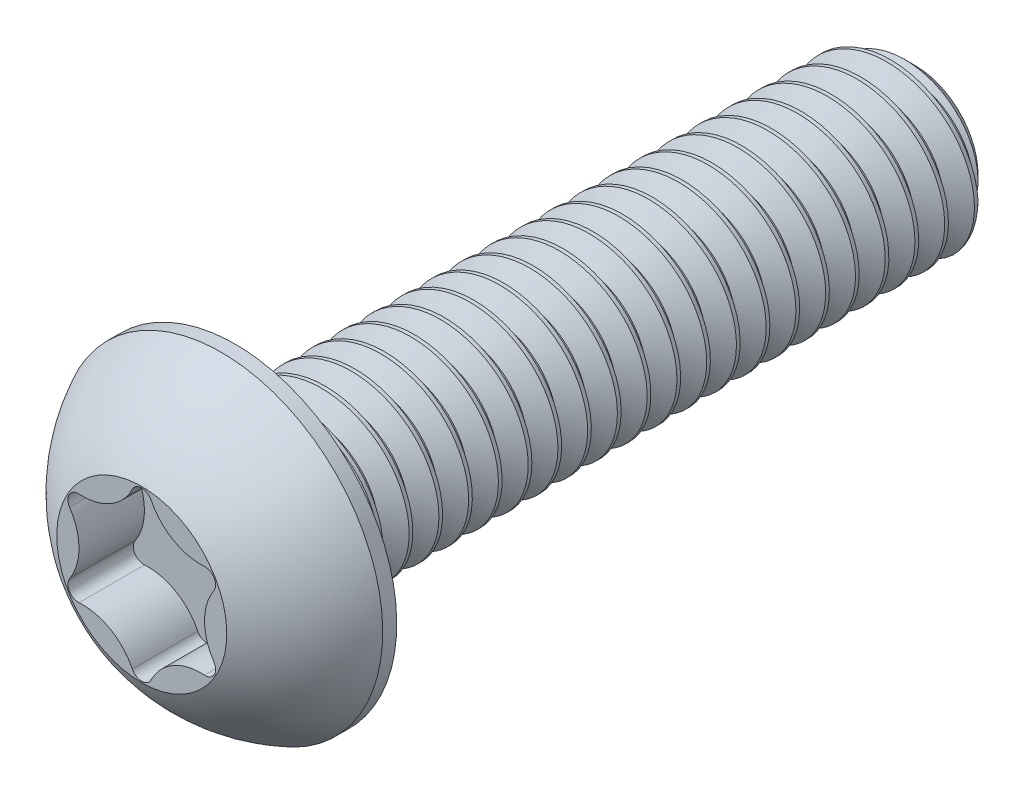
from build123d import *

# Parameters (mm, degrees)
SKETCH12_W         = 16
SKETCH12_H         = 2
CUT_EXTRUDE4_DEPTH = 1.54
CIRPATTERN1_COUNT  = 6
CHAMFER1_SIZE      = 0.525
CUT_SWEEP1_PITCH   = 0.7
CUT_SWEEP1_TO      = 16


with BuildPart() as part:
    # Sketch12 → Revolve1 (revolve)
    with BuildSketch(Plane(origin=(0, 0, 0), x_dir=(0, 0, -1), z_dir=(1, 0, 0))):
        with Locations((0, 1)):
            Rectangle(SKETCH12_W, SKETCH12_H)
    revolve(axis=Axis((0, 0, -8), (0, 0, 1)))

    # Sketch7 → Revolve2 (revolve)
    with BuildSketch(Plane(origin=(0, 0, 0), x_dir=(0, 0, -1), z_dir=(1, 0, 0)), mode=Mode.PRIVATE) as revolve2_sk:
        with BuildLine():
            Line((-8.33, 3.8), (-8, 3.8))
            Line((-8, 3.8), (-8, 0))
            Line((-8, 0), (-10.2, 0))
            Line((-10.2, 0), (-10.2, 2))
            ThreePointArc((-10.2, 2), (-9.406499853, 3.047002626), (-8.33, 3.8))
        make_face()
    revolve(revolve2_sk.sketch.rotate(Axis((0, 0, 10.2), (0, 0, -1)), 180), axis=Axis((0, 0, 10.2), (0, 0, -1)))

    # Sketch11 → Cut-Extrude4 (cut)
    with BuildSketch(Plane.XY.offset(10.2)):
        with BuildLine():
            Line((0, 0), (-1.704771007, 0.98425))
            ThreePointArc((-1.704771007, 0.98425), (-1.737604406, 0.853137928), (-1.696234895, 0.724464034))
            ThreePointArc((-1.696234895, 0.724464034), (-1.476375, 0), (-1.696234895, -0.724464034))
            ThreePointArc((-1.696234895, -0.724464034), (-1.737604406, -0.853137928), (-1.704771007, -0.98425))
            Line((-1.704771007, -0.98425), (0, 0))
        make_face()
    cut_extrude4 = extrude(amount=-CUT_EXTRUDE4_DEPTH, mode=Mode.SUBTRACT)

    # CirPattern1: Cut-Extrude4 ×6 about axis
    cirpattern1_axis = Axis((0, 0, 0), (0, 0, -1))
    for i in range(1, CIRPATTERN1_COUNT):
        add(cut_extrude4.rotate(cirpattern1_axis, i * 360 / CIRPATTERN1_COUNT), mode=Mode.SUBTRACT)

    # Chamfer1
    chamfer1_edges = [part.edges().sort_by_distance(p)[0] for p in [
        (0, -2, -8),
    ]]
    chamfer(chamfer1_edges, length=CHAMFER1_SIZE)


with BuildPart() as body_2:
    # Split1: read off the stored shape, not the designer's step
    # Split1: the piece on the far side of the plane
    add(part.part)
    split(bisect_by=Plane.XY.offset(8), keep=Keep.BOTTOM)

    # Cut-Sweep1: arcs per turn and ends read off the stored shape
    # Cut-Sweep1: the profile of Sketch14 screwed along a right-hand helix through 23.857143 turns, 6 arcs to a turn; built about Z, then put on its axis
    cut_sweep1_z = Axis((0, 0, 0), (0, 0, 1))
    cut_sweep1_corners = [(1.545336663, 0, -0.2625), (2.037888611, 0, 0.021875), (2.037888611, 0, -0.634375), (1.545336663, 0, -0.35)]
    with BuildLine(mode=Mode.PRIVATE) as cut_sweep1_profile:
        Line(cut_sweep1_corners[0], cut_sweep1_corners[1])
        Line(cut_sweep1_corners[1], cut_sweep1_corners[2])
        Line(cut_sweep1_corners[2], cut_sweep1_corners[3])
        Line(cut_sweep1_corners[3], cut_sweep1_corners[0])
    cut_sweep1_cap = Face(cut_sweep1_profile.wire())
    cut_sweep1_turn_angles = [0, 30, 60, 90, 120, 150, 180, 210, 240, 270, 300, 330, 360]
    cut_sweep1_turn_weights = [1, 0.8660254037844387, 1, 0.8660254037844387, 1, 0.8660254037844387, 1, 0.8660254037844387, 1, 0.8660254037844387, 1, 0.8660254037844387, 1]
    cut_sweep1_turn_rails = [Edge.make_bspline([Vector(p[0], p[1], 0).rotate(cut_sweep1_z, cut_sweep1_turn_angles[k]) / cut_sweep1_turn_weights[k] + Vector(0, 0, p[2] + CUT_SWEEP1_PITCH * cut_sweep1_turn_angles[k] / 360) for k in range(13)], [0, 0, 0, 1, 1, 2, 2, 3, 3, 4, 4, 5, 5, 6, 6, 6], 2, cut_sweep1_turn_weights) for p in cut_sweep1_corners]
    cut_sweep1_turn_sides = [Face.make_surface_from_curves(cut_sweep1_turn_rails[p[0]], cut_sweep1_turn_rails[p[1]]) for p in [(0, 1), (1, 2), (2, 3), (3, 0)]]
    cut_sweep1_last_angles = [8280, 8310, 8340, 8370, 8400, 8430, 8460, 8490, 8520, 8550, 8580, 8584.285714286, 8588.571428571]
    cut_sweep1_last_weights = [1, 0.8660254037844387, 1, 0.8660254037844387, 1, 0.8660254037844387, 1, 0.8660254037844387, 1, 0.8660254037844387, 1, 0.9972037971811962, 1]
    cut_sweep1_last_rails = [Edge.make_bspline([Vector(p[0], p[1], 0).rotate(cut_sweep1_z, cut_sweep1_last_angles[k]) / cut_sweep1_last_weights[k] + Vector(0, 0, p[2] + CUT_SWEEP1_PITCH * cut_sweep1_last_angles[k] / 360) for k in range(13)], [0, 0, 0, 1, 1, 2, 2, 3, 3, 4, 4, 5, 5, 6, 6, 6], 2, cut_sweep1_last_weights) for p in cut_sweep1_corners]
    cut_sweep1_last_sides = [Face.make_surface_from_curves(cut_sweep1_last_rails[p[0]], cut_sweep1_last_rails[p[1]]) for p in [(0, 1), (1, 2), (2, 3), (3, 0)]]
    cut_sweep1 = Plane(origin=(0, 0, -8), x_dir=(0, 1, 0), z_dir=(0, 0, 1)) * split(Solid(Shell([*[p.moved(Location((0, 0, CUT_SWEEP1_PITCH * i))) for i in range(23) for p in cut_sweep1_turn_sides], *cut_sweep1_last_sides, cut_sweep1_cap, cut_sweep1_cap.rotate(cut_sweep1_z, 8588.571428571).moved(Location((0, 0, CUT_SWEEP1_PITCH * 8588.571428571 / 360)))])), bisect_by=Plane.XY.offset(CUT_SWEEP1_TO), keep=Keep.BOTTOM, mode=Mode.PRIVATE)
    add(cut_sweep1, mode=Mode.SUBTRACT)


with BuildPart() as part_1:
    add(part.part)

    # Split1
    split(bisect_by=Plane.XY.offset(8), keep=Keep.TOP)

    # Combine1: union body 2
    add(body_2.part)


solid = part_1.part
